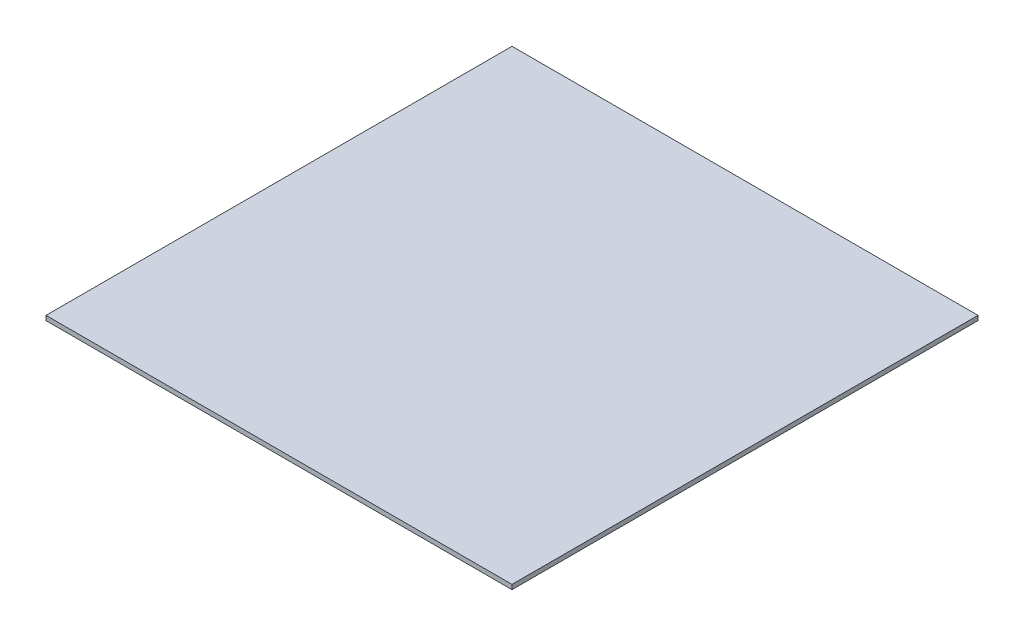
from build123d import *

# Parameters (mm, degrees)
SKETCH1_W           = 304.8
SKETCH1_H           = 304.8
BOSS_EXTRUDE1_DEPTH = 3


with BuildPart() as part:
    # Sketch1 → Boss-Extrude1 (new body)
    with BuildSketch(Plane(origin=(0, 0, 0), x_dir=(1, 0, 0), z_dir=(0, 1, 0))):
        Rectangle(SKETCH1_W, SKETCH1_H)
    extrude(amount=BOSS_EXTRUDE1_DEPTH)


solid = part.part
